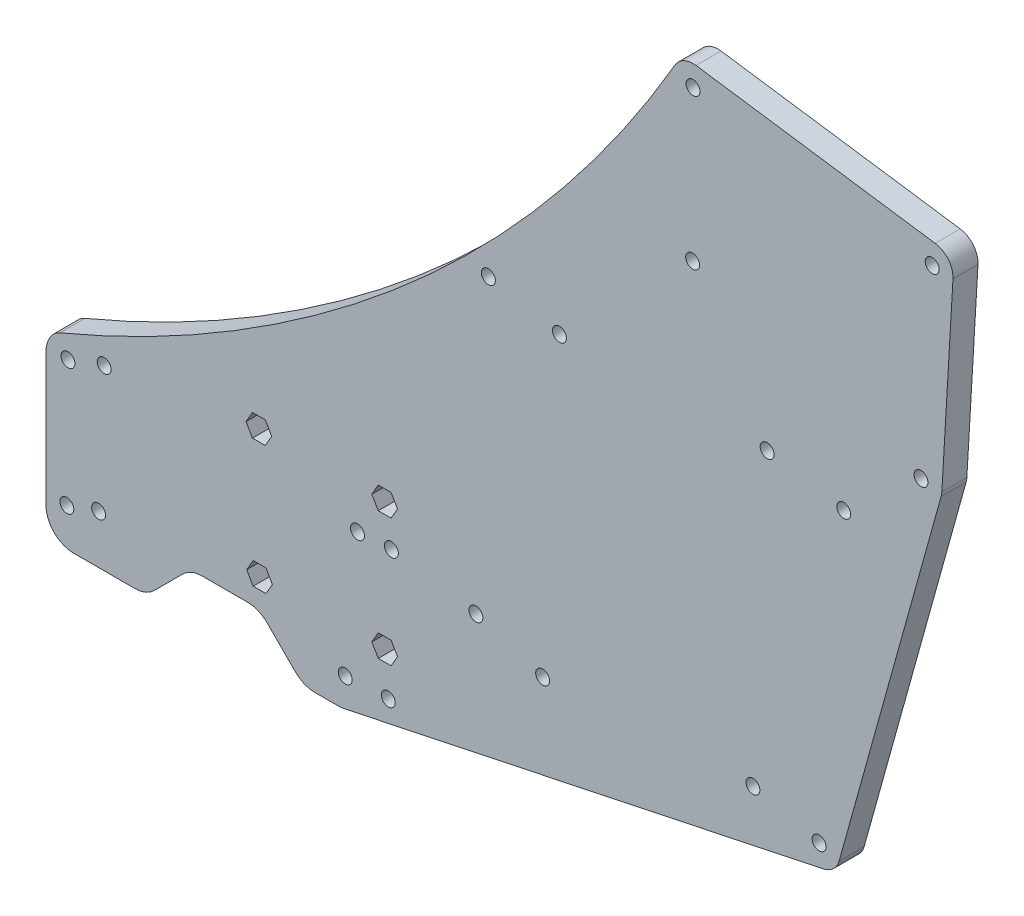
from build123d import *

# Parameters (mm, degrees)
SKETCH2_R           = 2.499965
SKETCH2_R_2         = 2.49997
SKETCH2_R_3         = 2.4999655
SKETCH2_R_4         = 2.499962807
SKETCH2_R_5         = 2.4999705
SKETCH2_R_6         = 2.499967809
SKETCH2_R_7         = 2.499966
SKETCH2_R_8         = 2.4999665
SKETCH2_R_9         = 2.499966488
BOSS_EXTRUDE1_DEPTH = 9
CUT_EXTRUDE1_DEPTH  = 10
CUT_EXTRUDE2_DEPTH  = 244.998875453
SKETCH5_R           = 2.5
CUT_EXTRUDE3_DEPTH  = 244.998875453
CUT_EXTRUDE5_DEPTH  = 10
FILLET1_R           = 10
CUT_EXTRUDE7_DEPTH  = 244.998875453


with BuildPart() as part:
    # Sketch2 → Boss-Extrude1 (new body)
    with BuildSketch(Plane.XY):
        Polygon((-211.70586, -139.55845), (122.983766, -139.55845), (211.70583, 139.558464), (-211.70586, 139.558464), align=None)
        with Locations((-192.444718, -125.900476)):
            Circle(SKETCH2_R, mode=Mode.SUBTRACT)
        with Locations((-181.028235, -121.988219)):
            Circle(SKETCH2_R_2, mode=Mode.SUBTRACT)
        with Locations((-192.0409685, -80.3042345)):
            Circle(SKETCH2_R_3, mode=Mode.SUBTRACT)
        with Locations((-179.0281635, -75.623296193)):
            Circle(SKETCH2_R_4, mode=Mode.SUBTRACT)
        with Locations((-92.3000565, -128.9494755)):
            Circle(SKETCH2_R_5, mode=Mode.SUBTRACT)
        with Locations((-76.832143809, -128.336904809)):
            Circle(SKETCH2_R_6, mode=Mode.SUBTRACT)
        with Locations((-87.928392809, -81.863553809)):
            Circle(SKETCH2_R_6, mode=Mode.SUBTRACT)
        with Locations((-75.718345809, -81.250965809)):
            Circle(SKETCH2_R_6, mode=Mode.SUBTRACT)
        with Locations((-45.325502, -86.123854)):
            Circle(SKETCH2_R, mode=Mode.SUBTRACT)
        with Locations((-21.323083, -93.781229)):
            Circle(SKETCH2_R_7, mode=Mode.SUBTRACT)
        with Locations((54.304011, -89.994307)):
            Circle(SKETCH2_R_7, mode=Mode.SUBTRACT)
        with Locations((78.1115035, -95.7303835)):
            Circle(SKETCH2_R_8, mode=Mode.SUBTRACT)
        with Locations((114.776659, 36.09363)):
            Circle(SKETCH2_R, mode=Mode.SUBTRACT)
        with Locations((86.96623, 12.266557)):
            Circle(SKETCH2_R_7, mode=Mode.SUBTRACT)
        with Locations((59.4275, 17.097677)):
            Circle(SKETCH2_R, mode=Mode.SUBTRACT)
        with Locations((-40.842451, 21.163049)):
            Circle(SKETCH2_R, mode=Mode.SUBTRACT)
        with Locations((-15.2807135, 15.9838705)):
            Circle(SKETCH2_R_8, mode=Mode.SUBTRACT)
        with Locations((32.626661, 62.749598)):
            Circle(SKETCH2_R_7, mode=Mode.SUBTRACT)
        with Locations((118.780878488, 104.469667)):
            Circle(SKETCH2_R_9, mode=Mode.SUBTRACT)
        with Locations((32.7798015, 116.8664005)):
            Circle(SKETCH2_R_8, mode=Mode.SUBTRACT)
    extrude(amount=BOSS_EXTRUDE1_DEPTH)

    # Sketch3 → Cut-Extrude1 (cut)
    with BuildSketch(Plane.XY.offset(9)):
        Polygon((147.113293383, 124.3664005), (73.705987484, -139.55845), (211.70583, -139.55845), (211.70583, 139.558464), (-211.70586, 139.558464), (-211.70586, -139.55845), (-199.944718, -139.55845), (-199.944718, -77.260214262), (29.956914073, 124.3664005), align=None)
    extrude(amount=-CUT_EXTRUDE1_DEPTH, mode=Mode.SUBTRACT)

    # Sketch4 → Cut-Extrude2 (cut, through all)
    with BuildSketch(Plane.XY.offset(9)):
        Polygon((-163.885127, -139.55845), (-147.880898, -123.554221), (-123.333708966, -123.554221), (-107.329479966, -139.55845), align=None)
    extrude(amount=-CUT_EXTRUDE2_DEPTH, mode=Mode.SUBTRACT)

    # Sketch5 → Cut-Extrude3 (cut, through all)
    with BuildSketch(Plane.XY.offset(9)):
        with Locations((-123.130898, -113.554221)):
            Circle(SKETCH5_R)
        with Locations((-78.130898, -113.554221)):
            Circle(SKETCH5_R)
        with Locations((-123.380898, -67.554221)):
            Circle(SKETCH5_R)
        with Locations((-78.130898, -67.554221)):
            Circle(SKETCH5_R)
    extrude(amount=-CUT_EXTRUDE3_DEPTH, mode=Mode.SUBTRACT)

    # Sketch6 → Cut-Extrude5 (cut)
    with BuildSketch(Plane.XY.offset(9)):
        with BuildLine():
            Line((-195.525508542, -73.384512142), (-194.933621691, -73.384512142))
            ThreePointArc((-194.933621691, -73.384512142), (-115.656074248, -30.741284252), (-46.149790694, 26.462307945))
            ThreePointArc((-46.149790694, 26.462307945), (-6.887258575, 71.211725192), (26.296691523, 120.637247226))
            Line((26.296691523, 120.637247226), (26.296691523, 121.156339417))
            Line((26.296691523, 121.156339417), (-195.525508542, -73.384512142))
        make_face()
        Polygon((147.113293383, 35.655168177), (147.113293383, 124.3664005), (122.439403996, 35.655168177), align=None)
        Polygon((-75.287663516, -135.676154132), (-93.736030822, -139.55845), (73.705987484, -139.55845), (83.854883116, -103.069632849), (79.655983667, -103.069632849), align=None)
        with BuildLine():
            Line((79.655983667, -103.069632849), (83.854883116, -103.069632849))
            Line((83.854883116, -103.069632849), (85.337218021, -97.740122205))
            ThreePointArc((85.337218021, -97.740122205), (83.24278011, -101.200301265), (79.655983667, -103.069632849))
        make_face()
        with BuildLine():
            ThreePointArc((-196.986177186, -74.665536862), (-196.011897332, -73.941709513), (-194.933621691, -73.384512142))
            Line((-194.933621691, -73.384512142), (-195.525508542, -73.384512142))
            Line((-195.525508542, -73.384512142), (-196.986177186, -74.665536862))
        make_face()
        Polygon((26.296691523, 124.3664005), (26.296691523, 121.156339417), (27.834592626, 122.505097973), (29.956914073, 124.3664005), align=None)
        with BuildLine():
            Line((27.834592626, 122.505097973), (26.296691523, 121.156339417))
            Line((26.296691523, 121.156339417), (26.296691523, 120.637247226))
            ThreePointArc((26.296691523, 120.637247226), (26.989824424, 121.633597313), (27.834592626, 122.505097973))
        make_face()
        with BuildLine():
            Line((29.956914073, 124.3664005), (27.834592626, 122.505097973))
            ThreePointArc((27.834592626, 122.505097973), (30.137854408, 123.885667952), (32.779801516, 124.3664005))
            Line((32.779801516, 124.3664005), (29.956914073, 124.3664005))
        make_face()
        with BuildLine():
            Line((147.113293383, 124.3664005), (32.779801516, 124.3664005))
            ThreePointArc((32.779801516, 124.3664005), (33.31619378, 124.347194798), (33.849838899, 124.289676055))
            Line((33.849838899, 124.289676055), (119.850915887, 111.892942555))
            ThreePointArc((119.850915887, 111.892942555), (124.449885477, 109.380100764), (126.280878488, 104.469667))
            ThreePointArc((126.280878488, 104.469667), (126.277670913, 104.250342289), (126.268050933, 104.031205177))
            Line((126.268050933, 104.031205177), (122.263831446, 35.655168177))
            Line((122.263831446, 35.655168177), (122.439403996, 35.655168177))
            Line((122.439403996, 35.655168177), (147.113293383, 124.3664005))
        make_face()
        with BuildLine():
            Line((122.002373456, 34.083891063), (122.439403996, 35.655168177))
            Line((122.439403996, 35.655168177), (122.263831446, 35.655168177))
            ThreePointArc((122.263831446, 35.655168177), (122.174935028, 34.862568747), (122.002373456, 34.083891063))
        make_face()
    extrude(amount=-CUT_EXTRUDE5_DEPTH, mode=Mode.SUBTRACT)

    # Fillet1
    # the kernel refuses this fillet: 10 mm, written as the material it adds along each edge
    with BuildSketch(Plane(origin=(-147.880898, -123.554221, 9), x_dir=(1, 0, 0), z_dir=(0, 0, -1)), Plane(origin=(-123.333708966, -123.554221, 9), x_dir=(0.707106781186551, -0.7071067811865441, 0), z_dir=(0, 0, -1))) as fillet1_piece_1:
        with BuildLine():
            CenterArc((FILLET1_R * 0.414213562373, FILLET1_R), FILLET1_R, 225, 45)
            Line((-FILLET1_R * 0.292893218813, FILLET1_R * 0.292893218813), (0, 0))
            Line((0, 0), (FILLET1_R * 0.414213562373, 0))
        make_face()
    extrude(amount=9)
    # the kernel refuses this fillet: 10 mm, written as the material it takes off along each edge
    with BuildSketch(Plane(origin=(-199.944718, -77.260214262, 20.264688934), x_dir=(0, -1, 0), z_dir=(0, 0, -1))) as fillet1_2_piece_1:
        with BuildLine():
            CenterArc((4.505875574, -10), FILLET1_R, 90, 45.239414653)
            Line((-2.5946774, -2.958540814), (0, 0))
            Line((0, 0), (4.505875574, 0))
        make_face()
    extrude(amount=31.529377868, mode=Mode.SUBTRACT)
    with BuildSketch(Plane(origin=(-163.885127, -139.55845, 19.355339059), x_dir=(-1, 0, 0), z_dir=(0, 0, -1)), Plane(origin=(-107.329479966, -139.55845, 19.355339059), x_dir=(-0.707106781186551, 0.7071067811865441, 0), z_dir=(0, 0, -1))) as fillet1_2_piece_2:
        with BuildLine():
            CenterArc((FILLET1_R * 0.414213562373, FILLET1_R), FILLET1_R, 225, 45)
            Line((-FILLET1_R * 0.292893218813, FILLET1_R * 0.292893218813), (0, 0))
            Line((0, 0), (FILLET1_R * 0.414213562373, 0))
        make_face()
    extrude(amount=29.710678119, mode=Mode.SUBTRACT)
    with BuildSketch(Plane(origin=(-93.736030822, -139.55845, 11.602018692), x_dir=(-1, 0, 0), z_dir=(0, 0, -1))) as fillet1_2_piece_3:
        with BuildLine():
            CenterArc((FILLET1_R * 0.104080747675, FILLET1_R), FILLET1_R, 258.116013885, 11.883986115)
            Line((-FILLET1_R * 0.101849941288, FILLET1_R * 0.0214334200765), (0, 0))
            Line((0, 0), (FILLET1_R * 0.104080747675, 0))
        make_face()
    extrude(amount=14.204037384, mode=Mode.SUBTRACT)
    with BuildSketch(Plane(origin=(-199.944718, -139.55845, 34), x_dir=(1, 0, 0), z_dir=(0, 0, -1))) as fillet1_2_piece_4:
        with BuildLine():
            CenterArc((FILLET1_R, -FILLET1_R), FILLET1_R, 90, 90)
            Line((0, -FILLET1_R), (0, 0))
            Line((0, 0), (FILLET1_R, 0))
        make_face()
    extrude(amount=59, mode=Mode.SUBTRACT)

    # Sketch7 → Cut-Extrude7 (cut, through all)
    with BuildSketch(Plane.XY):
        Polygon((-118.512095846, -113.554221), (-120.821496923, -109.554221), (-125.440299077, -109.554221), (-127.749700154, -113.554221), (-125.440299077, -117.554221), (-120.821496923, -117.554221), align=None)
        Polygon((-82.749700154, -113.554221), (-80.440299077, -117.554221), (-75.821496923, -117.554221), (-73.512095846, -113.554221), (-75.821496923, -109.554221), (-80.440299077, -109.554221), align=None)
        Polygon((-80.440299077, -71.554221), (-75.821496923, -71.554221), (-73.512095846, -67.554221), (-75.821496923, -63.554221), (-80.440299077, -63.554221), (-82.749700154, -67.554221), align=None)
        Polygon((-121.071496923, -71.554221), (-118.762095846, -67.554221), (-121.071496923, -63.554221), (-125.690299077, -63.554221), (-127.999700154, -67.554221), (-125.690299077, -71.554221), align=None)
    extrude(amount=CUT_EXTRUDE7_DEPTH, mode=Mode.SUBTRACT)


solid = part.part
